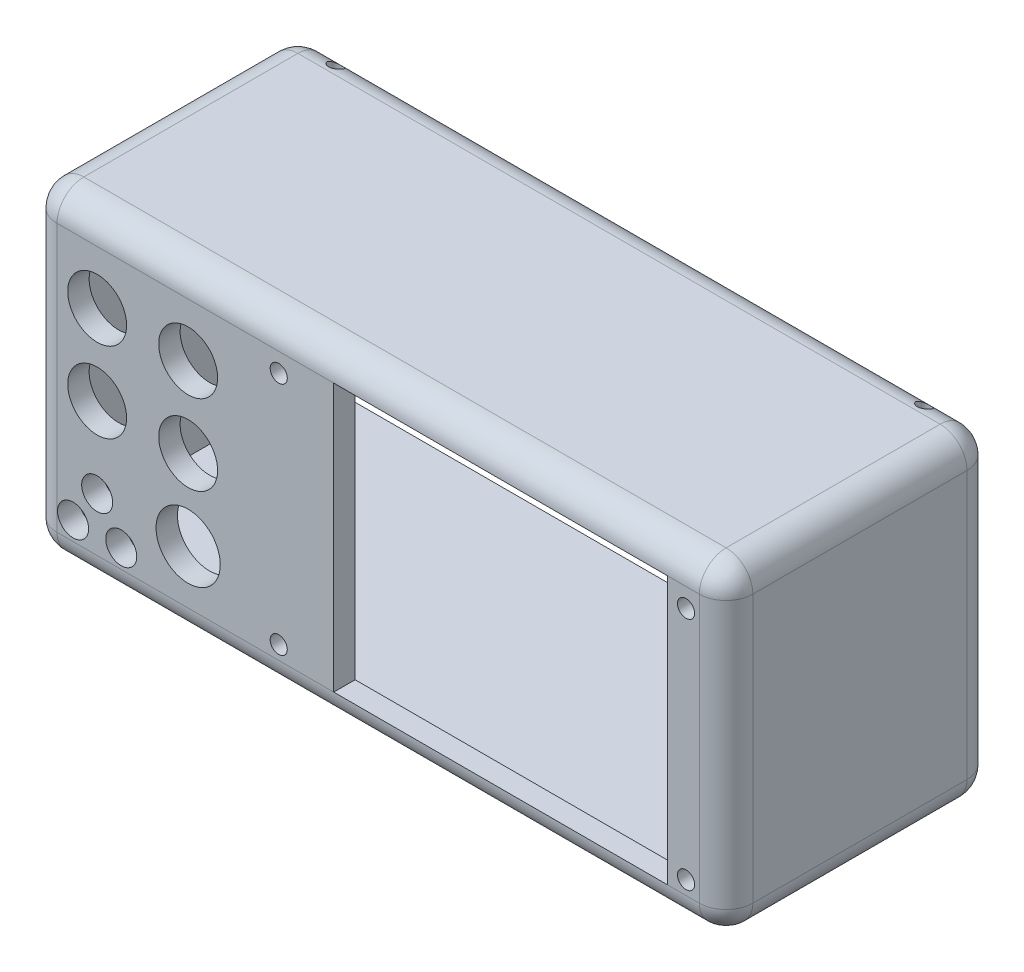
from build123d import *

# Parameters (mm, degrees)
SKETCH1_W           = 122
SKETCH1_H           = 52
SKETCH1_R           = 2.9
SKETCH1_R_2         = 6
SKETCH1_R_3         = 5.5
SKETCH1_W_2         = 62.4
SKETCH1_H_2         = 50
SKETCH1_R_4         = 1.6
BOSS_EXTRUDE1_DEPTH = 4
SKETCH1_3_W         = 4
SKETCH1_3_H         = 52
BOSS_EXTRUDE2_DEPTH = 50
SKETCH3_R           = 1.25
CUT_EXTRUDE1_DEPTH  = 104.879216611
FILLET2_R           = 5
FILLET3_R           = 5
FILLET4_R           = 5
FILLET5_R           = 5
FILLET6_R           = 5


# Some blends are built 0.0001 mm under size
with BuildPart() as part:
    # Sketch1 → Boss-Extrude1 (new body)
    with BuildSketch(Plane.XY):
        with Locations((3.490084273, -6.001542194)):
            Rectangle(SKETCH1_W, SKETCH1_H)
        with Locations((-53.509915727, -27.501542194)):
            Circle(SKETCH1_R, mode=Mode.SUBTRACT)
        with Locations((-44.509915727, -27.501542194)):
            Circle(SKETCH1_R, mode=Mode.SUBTRACT)
        with Locations((-49.009915727, -21.001542194)):
            Circle(SKETCH1_R, mode=Mode.SUBTRACT)
        with Locations((-32.009915727, -21.001542194)):
            Circle(SKETCH1_R_2, mode=Mode.SUBTRACT)
        with Locations((-49.009915727, -6.001542194)):
            Circle(SKETCH1_R_3, mode=Mode.SUBTRACT)
        with Locations((-32.009915727, -6.001542194)):
            Circle(SKETCH1_R_3, mode=Mode.SUBTRACT)
        with Locations((-49.009915727, 8.998457806)):
            Circle(SKETCH1_R_3, mode=Mode.SUBTRACT)
        with Locations((-32.009915727, 8.998457806)):
            Circle(SKETCH1_R_3, mode=Mode.SUBTRACT)
        with Locations((26.390084273, -6.001542194)):
            Rectangle(SKETCH1_W_2, SKETCH1_H_2, mode=Mode.SUBTRACT)
        with Locations((-15.089915727, 15.448457806)):
            Circle(SKETCH1_R_4, mode=Mode.SUBTRACT)
        with Locations((-15.089915727, -28.451542194)):
            Circle(SKETCH1_R_4, mode=Mode.SUBTRACT)
        with Locations((61.010084273, 15.448457806)):
            Circle(SKETCH1_R_4, mode=Mode.SUBTRACT)
        with Locations((61.010084273, -28.451542194)):
            Circle(SKETCH1_R_4, mode=Mode.SUBTRACT)
    extrude(amount=-BOSS_EXTRUDE1_DEPTH)

    # Sketch1<3> → Boss-Extrude2 (add)
    with BuildSketch(Plane.XY):
        Polygon((68.490084273, 23.998457806), (-61.509915727, 23.998457806), (-61.509915727, 19.998457806), (-57.509915727, 19.998457806), (64.490084273, 19.998457806), (68.490084273, 19.998457806), align=None)
        with Locations((-59.509915727, -6.001542194)):
            Rectangle(SKETCH1_3_W, SKETCH1_3_H)
        with Locations((66.490084273, -6.001542194)):
            Rectangle(SKETCH1_3_W, SKETCH1_3_H)
        Polygon((-57.509915727, -32.001542194), (-61.509915727, -32.001542194), (-61.509915727, -36.001542194), (68.490084273, -36.001542194), (68.490084273, -32.001542194), (64.490084273, -32.001542194), align=None)
    extrude(amount=-BOSS_EXTRUDE2_DEPTH)

    # Sketch3 → Cut-Extrude1 (cut, through all)
    with BuildSketch(Plane(origin=(0, 23.998457806, 0), x_dir=(1, 0, 0), z_dir=(0, 1, 0))):
        with Locations(Location((-51.509915727, 47, 0), (0, 0, 270))):
            Circle(SKETCH3_R)
        with Locations(Location((58.490084273, 47, 0), (0, 0, 270))):
            Circle(SKETCH3_R)
    extrude(amount=-CUT_EXTRUDE1_DEPTH, mode=Mode.SUBTRACT)

    # Fillet2
    fillet2_edges = [part.edges().sort_by_distance(p)[0] for p in [
        (-61.509915727, -6.001542194, 0),
    ]]
    fillet(fillet2_edges, radius=FILLET2_R)

    # Fillet3
    fillet3_edges = [part.edges().sort_by_distance(p)[0] for p in [
        (68.490084273, -6.001542194, 0),
    ]]
    fillet(fillet3_edges, radius=FILLET3_R)

    # Fillet4
    fillet4_edges = [part.edges().sort_by_distance(p)[0] for p in [
        (3.490084273, 23.998457806, 0),
        (-60.045449633, 23.998457806, -1.464466094),
        (67.025618179, 23.998457806, -1.464466094),
        (-61.509915727, 23.998457806, -27.5),
        (68.490084273, 23.998457806, -27.5),
    ]]
    fillet(fillet4_edges, radius=FILLET4_R - 0.0001)  # a hair under: the kernel refuses the full size

    # Fillet5
    fillet5_edges = [part.edges().sort_by_distance(p)[0] for p in [
        (-60.045449633, -36.001542194, -1.464466094),
        (3.490084273, -36.001542194, 0),
        (67.025618179, -36.001542194, -1.464466094),
        (68.490084273, -36.001542194, -27.5),
        (-61.509915727, -36.001542194, -27.5),
    ]]
    fillet(fillet5_edges, radius=FILLET5_R - 0.0001)  # a hair under: the kernel refuses the full size

    # Fillet6
    # the kernel refuses this fillet: 5 mm, written as the material it takes off along each edge
    with BuildSketch(Plane(origin=(-56.510015727, 18.998557806, -50), x_dir=(-1, 0, 0), z_dir=(0, -1, 0))) as fillet6_piece_1:
        with BuildLine():
            CenterArc((0, -4.9999), FILLET6_R, 0, 90)
            Line((5, -4.9999), (5.1, -4.9999))
            ThreePointArc((5.1, -4.9999), (5.0999, -2.49995), (5.0999, 0))
            Line((5.0999, 0), (4.9999, 0.1))
            ThreePointArc((4.9999, 0.1), (2.49995, 0.1), (0, 0.1001))
            Line((0, 0.1001), (0, 0.0001))
        make_face()
    revolve(axis=Axis((-56.510015727, 18.998557806, -50), (0, 0, -1)), revolution_arc=90, mode=Mode.SUBTRACT)
    with BuildSketch(Plane(origin=(-61.509915727, 18.998557806, -50), x_dir=(-2.0000400003242763e-05, 0, 0.9999999997999919), z_dir=(0, -1, 0)), Plane(origin=(68.490084273, -31.001642194, -50), x_dir=(2.0000400004663874e-05, 0, 0.9999999997999919), z_dir=(0, 1, 0))) as fillet6_piece_2:
        with BuildLine():
            CenterArc((4.999799999, -4.999999999), FILLET6_R, 89.998854061, 90)
            Line((-0.0002, -4.999899997), (-0.1002, -4.999897997))
            ThreePointArc((-0.1002, -4.999897997), (-0.10005, -2.499947999), (-0.1, 2e-06))
            Line((-0.1, 2e-06), (2e-06, 0.1))
            ThreePointArc((2e-06, 0.1), (2.499952, 0.09995), (4.999902001, 0.1))
            Line((4.999902001, 0.1), (4.999900001, 0))
        make_face()
    extrude(amount=50.0002, mode=Mode.SUBTRACT)
    with BuildSketch(Plane(origin=(-56.510015727, -31.001642194, -50), x_dir=(0, -1, 0), z_dir=(1, 0, 0))) as fillet6_piece_3:
        with BuildLine():
            CenterArc((0, -4.9999), FILLET6_R, 0, 90)
            Line((5, -4.9999), (5.1, -4.9999))
            ThreePointArc((5.1, -4.9999), (5.0999, -2.49995), (5.0999, 0))
            Line((5.0999, 0), (4.9999, 0.1))
            ThreePointArc((4.9999, 0.1), (2.49995, 0.1), (0, 0.1001))
            Line((0, 0.1001), (0, 0.0001))
        make_face()
    revolve(axis=Axis((-56.510015727, -31.001642194, -50), (0, 0, -1)), revolution_arc=90, mode=Mode.SUBTRACT)
    with BuildSketch(Plane(origin=(-56.510015727, -36.001542194, -50), x_dir=(0, -2.0000400004663874e-05, 0.9999999997999919), z_dir=(1, 0, 0)), Plane(origin=(63.490184273, 23.998457806, -50), x_dir=(0, 2.000040000395332e-05, 0.9999999997999919), z_dir=(-1, 0, 0))) as fillet6_piece_4:
        with BuildLine():
            CenterArc((4.999799999, -4.999999999), FILLET6_R, 89.998854061, 90)
            Line((-0.0002, -4.999899997), (-0.1002, -4.999897997))
            ThreePointArc((-0.1002, -4.999897997), (-0.10005, -2.499947999), (-0.1, 2e-06))
            Line((-0.1, 2e-06), (2e-06, 0.1))
            ThreePointArc((2e-06, 0.1), (2.499952, 0.09995), (4.999902001, 0.1))
            Line((4.999902001, 0.1), (4.999900001, 0))
        make_face()
    extrude(amount=120.0002, mode=Mode.SUBTRACT)
    with BuildSketch(Plane(origin=(63.490184273, -31.001642194, -50), x_dir=(0, -1, 0), z_dir=(-1, 0, 0))) as fillet6_piece_5:
        with BuildLine():
            CenterArc((0, 4.9999), FILLET6_R, 270, 90)
            Line((0, -0.0001), (0, -0.1001))
            ThreePointArc((0, -0.1001), (2.49995, -0.1), (4.9999, -0.1))
            Line((4.9999, -0.1), (5.0999, 0))
            ThreePointArc((5.0999, 0), (5.0999, 2.49995), (5.1, 4.9999))
            Line((5.1, 4.9999), (5, 4.9999))
        make_face()
    revolve(axis=Axis((63.490184273, -31.001642194, -50), (0, 0, 1)), revolution_arc=90, mode=Mode.SUBTRACT)
    with BuildSketch(Plane(origin=(63.490184273, 18.998557806, -50), x_dir=(1, 0, 0), z_dir=(0, -1, 0))) as fillet6_piece_6:
        with BuildLine():
            CenterArc((0, 4.9999), FILLET6_R, 270, 90)
            Line((0, -0.0001), (0, -0.1001))
            ThreePointArc((0, -0.1001), (2.49995, -0.1), (4.9999, -0.1))
            Line((4.9999, -0.1), (5.0999, 0))
            ThreePointArc((5.0999, 0), (5.0999, 2.49995), (5.1, 4.9999))
            Line((5.1, 4.9999), (5, 4.9999))
        make_face()
    revolve(axis=Axis((63.490184273, 18.998557806, -50), (0, 0, 1)), revolution_arc=90, mode=Mode.SUBTRACT)


solid = part.part
